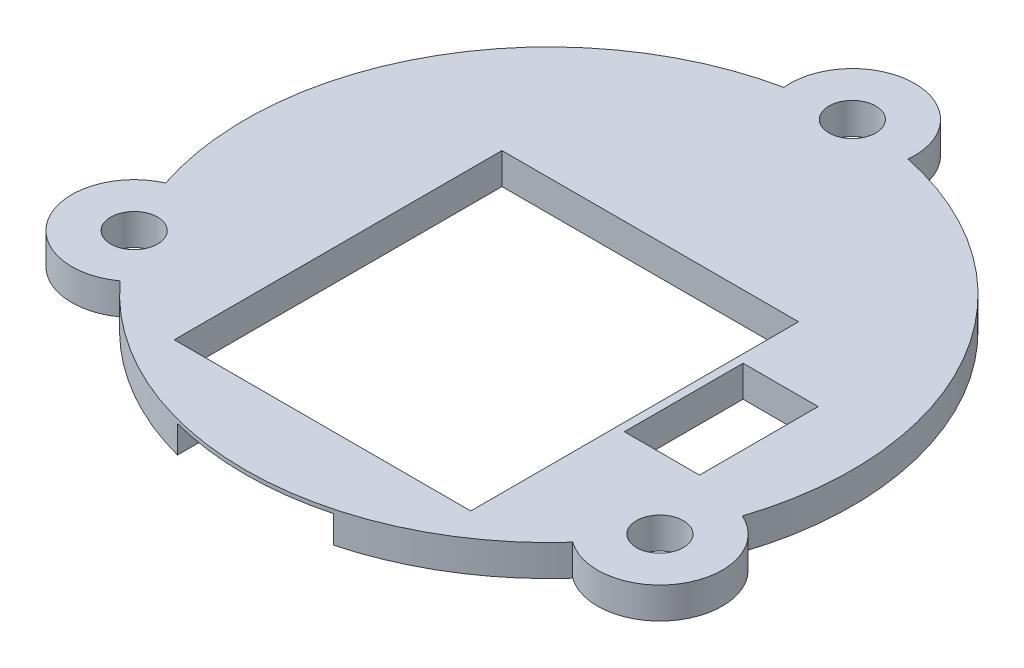
from build123d import *

# Parameters (mm, degrees)
ESQUISSE2_R                    = 19.45
BOSS_EXTRU_1_DEPTH             = 2
ESQUISSE2_3_R                  = 19.45
ESQUISSE2_3_R_2                = 4
ESQUISSE2_3_R_3                = 1.5
BOSS_EXTRU_2_DEPTH             = 2
ENL_V_MAT_EXTRU_2_DEPTH        = 2
R_P_TITION_CIRCULAIRE1_DEPTH   = 2
R_P_TITION_CIRCULAIRE1_2_DEPTH = 2
BOSS_EXTRU_3_DEPTH             = 0.8
CONG_1_R                       = 2
ESQUISSE6_W                    = 4.812747309
ESQUISSE6_H                    = 7.603139871
ENL_V_MAT_EXTRU_3_DEPTH        = 10
ESQUISSE7_W                    = 19
ESQUISSE7_H                    = 21
ENL_V_MAT_EXTRU_4_DEPTH        = 3.5
ESQUISSE8_W                    = 10
ESQUISSE8_H                    = 6.246978905
ENL_V_MAT_EXTRU_5_DEPTH        = 1.75


# Read off the part's stored shape, not the designer's step: Répétition circulaire1
with BuildPart() as part:
    # Esquisse2 → Boss.-Extru.1 (new body)
    with BuildSketch(Plane(origin=(0, 0, 0), x_dir=(1, 0, 0), z_dir=(0, 1, 0))):
        with Locations(Location((0, 0, 0), (0, 0, 270))):
            Circle(ESQUISSE2_R)
    extrude(amount=BOSS_EXTRU_1_DEPTH)

    # Esquisse2<3> → Boss.-Extru.2 (add)
    # profile 1 of 2: a face of its own
    with BuildSketch(Plane(origin=(0, 0, 0), x_dir=(1, 0, 0), z_dir=(0, 1, 0))):
        Circle(ESQUISSE2_3_R)
    # profile 2 of 2: a face of its own
    with BuildSketch(Plane(origin=(0, 0, 0), x_dir=(1, 0, 0), z_dir=(0, 1, 0))):
        with Locations((0, 19.45)):
            Circle(ESQUISSE2_3_R_2)
        with Locations((0, 19.45)):
            Circle(ESQUISSE2_3_R_3, mode=Mode.SUBTRACT)
    extrude(amount=BOSS_EXTRU_2_DEPTH)

    # Esquisse2<4> → Enlèv. mat.-Extru.2 (cut)
    with BuildSketch(Plane(origin=(0, 0, 0), x_dir=(1, 0, 0), z_dir=(0, 1, 0))):
        with BuildLine():
            ThreePointArc((1.498884406, 19.392159383), (0.75, 19.435534467), (0, 19.45))
            Line((0, 19.45), (0, 17.95))
            ThreePointArc((0, 17.95), (1.040009393, 18.369083508), (1.498884406, 19.392159383))
        make_face()
        with BuildLine():
            Line((0, 17.95), (0, 19.45))
            ThreePointArc((0, 19.45), (-0.75, 19.435534467), (-1.498884406, 19.392159383))
            ThreePointArc((-1.498884406, 19.392159383), (-1.040009393, 18.369083508), (0, 17.95))
        make_face()
    extrude(amount=ENL_V_MAT_EXTRU_2_DEPTH, mode=Mode.SUBTRACT)

    # Répétition circulaire1 outline → Répétition circulaire1 (cut)
    with BuildSketch(Plane(origin=(0, 0, 0), x_dir=(1, 0, 0), z_dir=(0, 1, 0))):
        with BuildLine():
            ThreePointArc((16.044660457, -10.994151664), (16.844194104, -9.725), (17.543544863, -8.398007718))
            ThreePointArc((17.543544863, -8.398007718), (15.545155998, -8.975), (16.044660457, -10.994151664))
        make_face()
        with BuildLine():
            ThreePointArc((-17.543544863, -8.398007718), (-16.844194104, -9.725), (-16.044660457, -10.994151664))
            ThreePointArc((-16.044660457, -10.994151664), (-15.545155998, -8.975), (-17.543544863, -8.398007718))
        make_face()
    extrude(amount=R_P_TITION_CIRCULAIRE1_DEPTH, mode=Mode.SUBTRACT)

    # R_p_tition circulaire1 2 outline → R_p_tition circulaire1 2 (add)
    with BuildSketch(Plane(origin=(0, 0, 0), x_dir=(1, 0, 0), z_dir=(0, 1, 0))):
        with BuildLine():
            ThreePointArc((17.543544863, -8.398007718), (18.14323221, -10.475), (16.044660457, -10.994151664))
            ThreePointArc((16.044660457, -10.994151664), (15.303387831, -12.004533347), (14.49858993, -12.965083496))
            ThreePointArc((14.49858993, -12.965083496), (20.308295719, -11.725), (18.477386634, -6.07360545))
            ThreePointArc((18.477386634, -6.07360545), (18.047924755, -7.250855952), (17.543544863, -8.398007718))
        make_face()
        with BuildLine():
            ThreePointArc((-18.477386634, -6.07360545), (-20.308295719, -11.725), (-14.49858993, -12.965083496))
            ThreePointArc((-14.49858993, -12.965083496), (-15.303387831, -12.004533347), (-16.044660457, -10.994151664))
            ThreePointArc((-16.044660457, -10.994151664), (-18.14323221, -10.475), (-17.543544863, -8.398007718))
            ThreePointArc((-17.543544863, -8.398007718), (-18.047924755, -7.250855952), (-18.477386634, -6.07360545))
        make_face()
    extrude(amount=R_P_TITION_CIRCULAIRE1_2_DEPTH)

    # Esquisse5 → Boss.-Extru.3 (add)
    with BuildSketch(Plane.XZ):
        with BuildLine():
            Line((8.673984211, -13.97728507), (9.39907569, -14.702376549))
            ThreePointArc((9.39907569, -14.702376549), (12.339013332, -12.339013332), (14.702376549, -9.39907569))
            Line((14.702376549, -9.39907569), (13.97728507, -8.673984211))
            ThreePointArc((13.97728507, -8.673984211), (11.631906551, -11.631906551), (8.673984211, -13.97728507))
        make_face()
        with BuildLine():
            ThreePointArc((-14.702376549, -9.39907569), (-12.339013332, -12.339013332), (-9.39907569, -14.702376549))
            Line((-9.39907569, -14.702376549), (-8.673984211, -13.97728507))
            ThreePointArc((-8.673984211, -13.97728507), (-11.631906551, -11.631906551), (-13.97728507, -8.673984211))
            Line((-13.97728507, -8.673984211), (-14.702376549, -9.39907569))
        make_face()
        with BuildLine():
            Line((13.97728507, 8.673984211), (14.702376549, 9.39907569))
            ThreePointArc((14.702376549, 9.39907569), (13.600367642, 10.933091969), (12.339013332, 12.339013332))
            Line((12.339013332, 12.339013332), (11.631906551, 11.631906551))
            ThreePointArc((11.631906551, 11.631906551), (12.88972459, 10.220445196), (13.97728507, 8.673984211))
        make_face()
        with BuildLine():
            ThreePointArc((-12.339013332, 12.339013332), (-13.600367642, 10.933091969), (-14.702376549, 9.39907569))
            Line((-14.702376549, 9.39907569), (-13.97728507, 8.673984211))
            ThreePointArc((-13.97728507, 8.673984211), (-12.88972459, 10.220445196), (-11.631906551, 11.631906551))
            Line((-11.631906551, 11.631906551), (-12.339013332, 12.339013332))
        make_face()
    extrude(amount=BOSS_EXTRU_3_DEPTH)

    # Congé1
    # the kernel refuses this fillet: 2 mm, written as the material it adds along each edge
    with BuildSketch(Plane(origin=(11.148857945, 0, 5.845557086), x_dir=(0.7071067811865459, 0, -0.7071067811865492), z_dir=(0.7071067811865492, 0, 0.7071067811865458))) as cong_1_piece_1_section:
        with BuildLine():
            CenterArc((1.6, -2), CONG_1_R, 90, 53.130102354)
            Line((0, -0.8), (-0.032, -0.776))
            ThreePointArc((-0.032, -0.776), (-0.04, -0.4), (-0.04, 0))
            Line((-0.04, 0), (0, 0.04))
            Line((0, 0.04), (1.6, 0.04))
            Line((1.6, 0.04), (1.6, 0))
        make_face()
    cong_1_piece_1 = extrude(amount=9.025434204, mode=Mode.PRIVATE)
    cong_1_piece_1 = cong_1_piece_1 & Plane(origin=(0, -0.204103776, 0), x_dir=(0.8425430686905786, 0, 0.5386289793554215), z_dir=(0, 1, 0)) * Cylinder(17.45, 25, mode=Mode.PRIVATE)
    cong_1_piece_1 = cong_1_piece_1 - Plane(origin=(0, -0.204103776, 0), x_dir=(0.7071067811865577, 0, 0.7071067811865375), z_dir=(0, 1, 0)) * Cylinder(16.45, 25, mode=Mode.PRIVATE)
    add(cong_1_piece_1)
    with BuildSketch(Plane(origin=(0, 0, 0), x_dir=(0.7071067811865576, 0, 0.7071067811865375), z_dir=(-0.7071067811865375, 0, 0.7071067811865576))) as cong_1_piece_2_section:
        with BuildLine():
            CenterArc((14.85, -2), CONG_1_R, 36.869897646, 53.130102354)
            Line((16.45, -0.8), (16.482, -0.776))
            ThreePointArc((16.482, -0.776), (16.49, -0.4), (16.49, 0))
            Line((16.49, 0), (16.45, 0.04))
            Line((16.45, 0.04), (14.85, 0.04))
            Line((14.85, 0.04), (14.85, 0))
        make_face()
    cong_1_piece_2 = revolve(axis=Axis((0, 0, 0), (0, 1, 0)), revolution_arc=27.109429972, mode=Mode.PRIVATE)
    cong_1_piece_2 = split(cong_1_piece_2, bisect_by=Plane(origin=(13.88723244, -0.204725798, 8.583931581), z_dir=(-0.7071067811865458, 0, 0.7071067811865492)), keep=Keep.TOP, mode=Mode.PRIVATE)
    add(cong_1_piece_2)
    with BuildSketch(Plane(origin=(0, 0, 0), x_dir=(-0.9516449769891426, 0, 0.30719999637261464), z_dir=(-0.30719999637261464, 0, -0.9516449769891426))) as cong_1_piece_3_section:
        with BuildLine():
            CenterArc((14.85, -2), CONG_1_R, 36.869897646, 53.130102354)
            Line((16.45, -0.8), (16.482, -0.776))
            ThreePointArc((16.482, -0.776), (16.49, -0.4), (16.49, 0))
            Line((16.49, 0), (16.45, 0.04))
            Line((16.45, 0.04), (14.85, 0.04))
            Line((14.85, 0.04), (14.85, 0))
        make_face()
    cong_1_piece_3 = revolve(axis=Axis((0, 0, 0), (0, 1, 0)), revolution_arc=27.109429972, mode=Mode.PRIVATE)
    cong_1_piece_3 = split(cong_1_piece_3, bisect_by=Plane(origin=(-13.887232342, -0.20472579, 8.583931483), z_dir=(0.7071067811865458, 0, 0.7071067811865493)), keep=Keep.TOP, mode=Mode.PRIVATE)
    add(cong_1_piece_3)
    with BuildSketch(Plane(origin=(-17.530803673, 0, 12.227502814), x_dir=(-0.7071067811865458, 0, -0.7071067811865493), z_dir=(0.7071067811865493, 0, -0.7071067811865458))) as cong_1_piece_4_section:
        with BuildLine():
            CenterArc((1.6, -2), CONG_1_R, 90, 53.130102354)
            Line((0, -0.8), (-0.032, -0.776))
            ThreePointArc((-0.032, -0.776), (-0.04, -0.4), (-0.04, 0))
            Line((-0.04, 0), (0, 0.04))
            Line((0, 0.04), (1.6, 0.04))
            Line((1.6, 0.04), (1.6, 0))
        make_face()
    cong_1_piece_4 = extrude(amount=9.025434204, mode=Mode.PRIVATE)
    cong_1_piece_4 = cong_1_piece_4 & Plane(origin=(0, -0.204103718, 0), x_dir=(-0.7071067811865558, 0, 0.7071067811865394), z_dir=(0, 1, 0)) * Cylinder(17.45, 25, mode=Mode.PRIVATE)
    cong_1_piece_4 = cong_1_piece_4 - Plane(origin=(0, -0.204103718, 0), x_dir=(-0.8496829829485655, 0, 0.527293872985101), z_dir=(0, 1, 0)) * Cylinder(16.45, 25, mode=Mode.PRIVATE)
    add(cong_1_piece_4)
    with BuildSketch(Plane(origin=(17.530803673, 0, -12.227502814), x_dir=(0.7071067811865459, 0, 0.7071067811865492), z_dir=(-0.7071067811865492, 0, 0.7071067811865458))) as cong_1_piece_5_section:
        with BuildLine():
            CenterArc((1.6, -2), CONG_1_R, 90, 53.130102354)
            Line((0, -0.8), (-0.032, -0.776))
            ThreePointArc((-0.032, -0.776), (-0.04, -0.4), (-0.04, 0))
            Line((-0.04, 0), (0, 0.04))
            Line((0, 0.04), (1.6, 0.04))
            Line((1.6, 0.04), (1.6, 0))
        make_face()
    cong_1_piece_5 = extrude(amount=9.025434204, mode=Mode.PRIVATE)
    cong_1_piece_5 = cong_1_piece_5 & Plane(origin=(0, -0.204103718, 0), x_dir=(0.5386289793554239, 0, -0.8425430686905769), z_dir=(0, 1, 0)) * Cylinder(17.45, 25, mode=Mode.PRIVATE)
    cong_1_piece_5 = cong_1_piece_5 - Plane(origin=(0, -0.204103718, 0), x_dir=(0.849682982948563, 0, -0.5272938729851051), z_dir=(0, 1, 0)) * Cylinder(16.45, 25, mode=Mode.PRIVATE)
    add(cong_1_piece_5)
    with BuildSketch(Plane(origin=(0, 0, 0), x_dir=(0.9516469062705674, 0, -0.30719401977521954), z_dir=(0.30719401977521954, 0, 0.9516469062705674))) as cong_1_piece_6_section:
        with BuildLine():
            CenterArc((14.85, -2), CONG_1_R, 36.869897646, 53.130102354)
            Line((16.45, -0.8), (16.482, -0.776))
            ThreePointArc((16.482, -0.776), (16.49, -0.4), (16.49, 0))
            Line((16.49, 0), (16.45, 0.04))
            Line((16.45, 0.04), (14.85, 0.04))
            Line((14.85, 0.04), (14.85, 0))
        make_face()
    cong_1_piece_6 = revolve(axis=Axis((0, 0, 0), (0, 1, 0)), revolution_arc=54.21957961, mode=Mode.PRIVATE)
    cong_1_piece_6 = split(cong_1_piece_6, bisect_by=Plane(origin=(8.583931605, -0.20472582, -13.887232464), z_dir=(0.7071067811865467, 0, 0.7071067811865485)), keep=Keep.TOP, mode=Mode.PRIVATE)
    cong_1_piece_6 = split(cong_1_piece_6, bisect_by=Plane(origin=(13.887232464, -0.20472582, -8.583931605), z_dir=(-0.7071067811865458, 0, -0.7071067811865492)), keep=Keep.TOP, mode=Mode.PRIVATE)
    add(cong_1_piece_6)
    with BuildSketch(Plane(origin=(5.845557086, 0, -11.148857945), x_dir=(-0.7071067811865465, 0, -0.7071067811865485), z_dir=(0.7071067811865485, 0, -0.7071067811865467))) as cong_1_piece_7_section:
        with BuildLine():
            CenterArc((1.6, -2), CONG_1_R, 90, 53.130102354)
            Line((0, -0.8), (-0.032, -0.776))
            ThreePointArc((-0.032, -0.776), (-0.04, -0.4), (-0.04, 0))
            Line((-0.04, 0), (0, 0.04))
            Line((0, 0.04), (1.6, 0.04))
            Line((1.6, 0.04), (1.6, 0))
        make_face()
    cong_1_piece_7 = extrude(amount=9.025434204, mode=Mode.PRIVATE)
    cong_1_piece_7 = cong_1_piece_7 & Plane(origin=(0, -0.204103776, 0), x_dir=(0.5386289793554239, 0, -0.8425430686905769), z_dir=(0, 1, 0)) * Cylinder(17.45, 25, mode=Mode.PRIVATE)
    cong_1_piece_7 = cong_1_piece_7 - Plane(origin=(0, -0.204103776, 0), x_dir=(0.849682982948563, 0, -0.5272938729851051), z_dir=(0, 1, 0)) * Cylinder(16.45, 25, mode=Mode.PRIVATE)
    add(cong_1_piece_7)
    with BuildSketch(Plane(origin=(-12.227502814, 0, -17.530803673), x_dir=(0.7071067811865467, 0, -0.7071067811865483), z_dir=(0.7071067811865485, 0, 0.7071067811865467))) as cong_1_piece_8_section:
        with BuildLine():
            CenterArc((1.6, -2), CONG_1_R, 90, 53.130102354)
            Line((0, -0.8), (-0.032, -0.776))
            ThreePointArc((-0.032, -0.776), (-0.04, -0.4), (-0.04, 0))
            Line((-0.04, 0), (0, 0.04))
            Line((0, 0.04), (1.6, 0.04))
            Line((1.6, 0.04), (1.6, 0))
        make_face()
    cong_1_piece_8 = extrude(amount=9.025434204, mode=Mode.PRIVATE)
    cong_1_piece_8 = cong_1_piece_8 & Plane(origin=(0, -0.204103718, 0), x_dir=(-0.8425430686905772, 0, -0.5386289793554238), z_dir=(0, 1, 0)) * Cylinder(17.45, 25, mode=Mode.PRIVATE)
    cong_1_piece_8 = cong_1_piece_8 - Plane(origin=(0, -0.204103718, 0), x_dir=(-0.5272938729851264, 0, -0.8496829829485496), z_dir=(0, 1, 0)) * Cylinder(16.45, 25, mode=Mode.PRIVATE)
    add(cong_1_piece_8)
    with BuildSketch(Plane(origin=(0, 0, 0), x_dir=(-0.30719401977524424, 0, -0.9516469062705595), z_dir=(0.9516469062705595, 0, -0.30719401977524424))) as cong_1_piece_9_section:
        with BuildLine():
            CenterArc((14.85, -2), CONG_1_R, 36.869897646, 53.130102354)
            Line((16.45, -0.8), (16.482, -0.776))
            ThreePointArc((16.482, -0.776), (16.49, -0.4), (16.49, 0))
            Line((16.49, 0), (16.45, 0.04))
            Line((16.45, 0.04), (14.85, 0.04))
            Line((14.85, 0.04), (14.85, 0))
        make_face()
    cong_1_piece_9 = revolve(axis=Axis((0, 0, 0), (0, 1, 0)), revolution_arc=54.21957961, mode=Mode.PRIVATE)
    cong_1_piece_9 = split(cong_1_piece_9, bisect_by=Plane(origin=(-8.583931605, -0.20472582, -13.887232464), z_dir=(-0.7071067811865467, 0, 0.7071067811865485)), keep=Keep.TOP, mode=Mode.PRIVATE)
    cong_1_piece_9 = split(cong_1_piece_9, bisect_by=Plane(origin=(-13.887232464, -0.20472582, -8.583931605), z_dir=(0.7071067811865458, 0, -0.7071067811865492)), keep=Keep.TOP, mode=Mode.PRIVATE)
    add(cong_1_piece_9)
    with BuildSketch(Plane(origin=(-11.148857945, 0, -5.845557086), x_dir=(-0.7071067811865459, 0, 0.7071067811865492), z_dir=(-0.7071067811865492, 0, -0.7071067811865458))) as cong_1_piece_10_section:
        with BuildLine():
            CenterArc((1.6, -2), CONG_1_R, 90, 53.130102354)
            Line((0, -0.8), (-0.032, -0.776))
            ThreePointArc((-0.032, -0.776), (-0.04, -0.4), (-0.04, 0))
            Line((-0.04, 0), (0, 0.04))
            Line((0, 0.04), (1.6, 0.04))
            Line((1.6, 0.04), (1.6, 0))
        make_face()
    cong_1_piece_10 = extrude(amount=9.025434204, mode=Mode.PRIVATE)
    cong_1_piece_10 = cong_1_piece_10 & Plane(origin=(0, -0.204103776, 0), x_dir=(-0.8425430686905772, 0, -0.5386289793554238), z_dir=(0, 1, 0)) * Cylinder(17.45, 25, mode=Mode.PRIVATE)
    cong_1_piece_10 = cong_1_piece_10 - Plane(origin=(0, -0.204103776, 0), x_dir=(-0.5272938729851264, 0, -0.8496829829485496), z_dir=(0, 1, 0)) * Cylinder(16.45, 25, mode=Mode.PRIVATE)
    add(cong_1_piece_10)
    with BuildSketch(Plane(origin=(11.148857945, 0, 5.845557086), x_dir=(0.7071067811865459, 0, -0.7071067811865492), z_dir=(0.7071067811865492, 0, 0.7071067811865458))) as cong_1_piece_11a_section:
        with BuildLine():
            CenterArc((1.6, -2), CONG_1_R, 90, 53.130102354)
            Line((0, -0.8), (-0.032, -0.776))
            ThreePointArc((-0.032, -0.776), (-0.04, -0.4), (-0.04, 0))
            Line((-0.04, 0), (0, 0.04))
            Line((0, 0.04), (1.6, 0.04))
            Line((1.6, 0.04), (1.6, 0))
        make_face()
    cong_1_piece_11a = extrude(amount=9.025434204, mode=Mode.PRIVATE)
    cong_1_piece_11a = cong_1_piece_11a & Plane(origin=(0, -0.207693111, 0), x_dir=(0.7071067811865577, 0, 0.7071067811865375), z_dir=(0, 1, 0)) * Cylinder(16.45, 25, mode=Mode.PRIVATE)
    with BuildSketch(Plane(origin=(0, 0, 0), x_dir=(0.7071067811865576, 0, 0.7071067811865375), z_dir=(-0.7071067811865375, 0, 0.7071067811865576))) as cong_1_piece_11b_section:
        with BuildLine():
            CenterArc((14.85, -2), CONG_1_R, 36.869897646, 53.130102354)
            Line((16.45, -0.8), (16.482, -0.776))
            ThreePointArc((16.482, -0.776), (16.49, -0.4), (16.49, 0))
            Line((16.49, 0), (16.45, 0.04))
            Line((16.45, 0.04), (14.85, 0.04))
            Line((14.85, 0.04), (14.85, 0))
        make_face()
    cong_1_piece_11b = revolve(axis=Axis((0, 0, 0), (0, 1, 0)), revolution_arc=27.109429972, mode=Mode.PRIVATE)
    cong_1_piece_11b = split(cong_1_piece_11b, bisect_by=Plane(origin=(13.273689354, -0.210053776, 7.970388495), z_dir=(0.7071067811865458, 0, -0.7071067811865492)), keep=Keep.TOP, mode=Mode.PRIVATE)
    cong_1_piece_11 = cong_1_piece_11a & cong_1_piece_11b
    add(cong_1_piece_11)
    with BuildSketch(Plane(origin=(0, 0, 0), x_dir=(-0.9516449769891426, 0, 0.30719999637261464), z_dir=(-0.30719999637261464, 0, -0.9516449769891426))) as cong_1_piece_12a_section:
        with BuildLine():
            CenterArc((14.85, -2), CONG_1_R, 36.869897646, 53.130102354)
            Line((16.45, -0.8), (16.482, -0.776))
            ThreePointArc((16.482, -0.776), (16.49, -0.4), (16.49, 0))
            Line((16.49, 0), (16.45, 0.04))
            Line((16.45, 0.04), (14.85, 0.04))
            Line((14.85, 0.04), (14.85, 0))
        make_face()
    cong_1_piece_12a = revolve(axis=Axis((0, 0, 0), (0, 1, 0)), revolution_arc=27.109429972, mode=Mode.PRIVATE)
    cong_1_piece_12a = split(cong_1_piece_12a, bisect_by=Plane(origin=(-13.273689161, -0.21005368, 7.970388302), z_dir=(-0.7071067811865458, 0, -0.7071067811865493)), keep=Keep.TOP, mode=Mode.PRIVATE)
    with BuildSketch(Plane(origin=(-17.530803673, 0, 12.227502814), x_dir=(-0.7071067811865458, 0, -0.7071067811865493), z_dir=(0.7071067811865493, 0, -0.7071067811865458))) as cong_1_piece_12b_section:
        with BuildLine():
            CenterArc((1.6, -2), CONG_1_R, 90, 53.130102354)
            Line((0, -0.8), (-0.032, -0.776))
            ThreePointArc((-0.032, -0.776), (-0.04, -0.4), (-0.04, 0))
            Line((-0.04, 0), (0, 0.04))
            Line((0, 0.04), (1.6, 0.04))
            Line((1.6, 0.04), (1.6, 0))
        make_face()
    cong_1_piece_12b = extrude(amount=9.025434204, mode=Mode.PRIVATE)
    cong_1_piece_12b = cong_1_piece_12b & Plane(origin=(0, -0.207693101, 0), x_dir=(-0.8496829829485655, 0, 0.527293872985101), z_dir=(0, 1, 0)) * Cylinder(16.45, 25, mode=Mode.PRIVATE)
    cong_1_piece_12 = cong_1_piece_12a & cong_1_piece_12b
    add(cong_1_piece_12)
    with BuildSketch(Plane(origin=(0, 0, 0), x_dir=(0.9516469062705674, 0, -0.30719401977521954), z_dir=(0.30719401977521954, 0, 0.9516469062705674))) as cong_1_piece_13a_section:
        with BuildLine():
            CenterArc((14.85, -2), CONG_1_R, 36.869897646, 53.130102354)
            Line((16.45, -0.8), (16.482, -0.776))
            ThreePointArc((16.482, -0.776), (16.49, -0.4), (16.49, 0))
            Line((16.49, 0), (16.45, 0.04))
            Line((16.45, 0.04), (14.85, 0.04))
            Line((14.85, 0.04), (14.85, 0))
        make_face()
    cong_1_piece_13a = revolve(axis=Axis((0, 0, 0), (0, 1, 0)), revolution_arc=54.21957961, mode=Mode.PRIVATE)
    cong_1_piece_13a = split(cong_1_piece_13a, bisect_by=Plane(origin=(13.27367534, -0.21005361, -7.970374481), z_dir=(0.7071067811865458, 0, 0.7071067811865492)), keep=Keep.TOP, mode=Mode.PRIVATE)
    with BuildSketch(Plane(origin=(17.530803673, 0, -12.227502814), x_dir=(0.7071067811865459, 0, 0.7071067811865492), z_dir=(-0.7071067811865492, 0, 0.7071067811865458))) as cong_1_piece_13b_section:
        with BuildLine():
            CenterArc((1.6, -2), CONG_1_R, 90, 53.130102354)
            Line((0, -0.8), (-0.032, -0.776))
            ThreePointArc((-0.032, -0.776), (-0.04, -0.4), (-0.04, 0))
            Line((-0.04, 0), (0, 0.04))
            Line((0, 0.04), (1.6, 0.04))
            Line((1.6, 0.04), (1.6, 0))
        make_face()
    cong_1_piece_13b = extrude(amount=9.025434204, mode=Mode.PRIVATE)
    cong_1_piece_13b = cong_1_piece_13b & Plane(origin=(0, -0.207693101, 0), x_dir=(0.849682982948563, 0, -0.5272938729851051), z_dir=(0, 1, 0)) * Cylinder(16.45, 25, mode=Mode.PRIVATE)
    cong_1_piece_13 = cong_1_piece_13a & cong_1_piece_13b
    add(cong_1_piece_13)
    with BuildSketch(Plane(origin=(5.845557086, 0, -11.148857945), x_dir=(-0.7071067811865465, 0, -0.7071067811865485), z_dir=(0.7071067811865485, 0, -0.7071067811865467))) as cong_1_piece_14a_section:
        with BuildLine():
            CenterArc((1.6, -2), CONG_1_R, 90, 53.130102354)
            Line((0, -0.8), (-0.032, -0.776))
            ThreePointArc((-0.032, -0.776), (-0.04, -0.4), (-0.04, 0))
            Line((-0.04, 0), (0, 0.04))
            Line((0, 0.04), (1.6, 0.04))
            Line((1.6, 0.04), (1.6, 0))
        make_face()
    cong_1_piece_14a = extrude(amount=9.025434204, mode=Mode.PRIVATE)
    cong_1_piece_14a = cong_1_piece_14a & Plane(origin=(0, -0.207693111, 0), x_dir=(0.849682982948563, 0, -0.5272938729851051), z_dir=(0, 1, 0)) * Cylinder(16.45, 25, mode=Mode.PRIVATE)
    with BuildSketch(Plane(origin=(0, 0, 0), x_dir=(0.9516469062705674, 0, -0.30719401977521954), z_dir=(0.30719401977521954, 0, 0.9516469062705674))) as cong_1_piece_14b_section:
        with BuildLine():
            CenterArc((14.85, -2), CONG_1_R, 36.869897646, 53.130102354)
            Line((16.45, -0.8), (16.482, -0.776))
            ThreePointArc((16.482, -0.776), (16.49, -0.4), (16.49, 0))
            Line((16.49, 0), (16.45, 0.04))
            Line((16.45, 0.04), (14.85, 0.04))
            Line((14.85, 0.04), (14.85, 0))
        make_face()
    cong_1_piece_14b = revolve(axis=Axis((0, 0, 0), (0, 1, 0)), revolution_arc=54.21957961, mode=Mode.PRIVATE)
    cong_1_piece_14b = split(cong_1_piece_14b, bisect_by=Plane(origin=(7.970374673, -0.210053705, -13.273675532), z_dir=(-0.7071067811865467, 0, -0.7071067811865485)), keep=Keep.TOP, mode=Mode.PRIVATE)
    cong_1_piece_14 = cong_1_piece_14a & cong_1_piece_14b
    add(cong_1_piece_14)
    with BuildSketch(Plane(origin=(-12.227502814, 0, -17.530803673), x_dir=(0.7071067811865467, 0, -0.7071067811865483), z_dir=(0.7071067811865485, 0, 0.7071067811865467))) as cong_1_piece_15a_section:
        with BuildLine():
            CenterArc((1.6, -2), CONG_1_R, 90, 53.130102354)
            Line((0, -0.8), (-0.032, -0.776))
            ThreePointArc((-0.032, -0.776), (-0.04, -0.4), (-0.04, 0))
            Line((-0.04, 0), (0, 0.04))
            Line((0, 0.04), (1.6, 0.04))
            Line((1.6, 0.04), (1.6, 0))
        make_face()
    cong_1_piece_15a = extrude(amount=9.025434204, mode=Mode.PRIVATE)
    cong_1_piece_15a = cong_1_piece_15a & Plane(origin=(0, -0.207693101, 0), x_dir=(-0.5272938729851264, 0, -0.8496829829485496), z_dir=(0, 1, 0)) * Cylinder(16.45, 25, mode=Mode.PRIVATE)
    with BuildSketch(Plane(origin=(0, 0, 0), x_dir=(-0.30719401977524424, 0, -0.9516469062705595), z_dir=(0.9516469062705595, 0, -0.30719401977524424))) as cong_1_piece_15b_section:
        with BuildLine():
            CenterArc((14.85, -2), CONG_1_R, 36.869897646, 53.130102354)
            Line((16.45, -0.8), (16.482, -0.776))
            ThreePointArc((16.482, -0.776), (16.49, -0.4), (16.49, 0))
            Line((16.49, 0), (16.45, 0.04))
            Line((16.45, 0.04), (14.85, 0.04))
            Line((14.85, 0.04), (14.85, 0))
        make_face()
    cong_1_piece_15b = revolve(axis=Axis((0, 0, 0), (0, 1, 0)), revolution_arc=54.21957961, mode=Mode.PRIVATE)
    cong_1_piece_15b = split(cong_1_piece_15b, bisect_by=Plane(origin=(-7.970374481, -0.21005361, -13.27367534), z_dir=(0.7071067811865467, 0, -0.7071067811865485)), keep=Keep.TOP, mode=Mode.PRIVATE)
    cong_1_piece_15 = cong_1_piece_15a & cong_1_piece_15b
    add(cong_1_piece_15)
    with BuildSketch(Plane(origin=(-11.148857945, 0, -5.845557086), x_dir=(-0.7071067811865459, 0, 0.7071067811865492), z_dir=(-0.7071067811865492, 0, -0.7071067811865458))) as cong_1_piece_16a_section:
        with BuildLine():
            CenterArc((1.6, -2), CONG_1_R, 90, 53.130102354)
            Line((0, -0.8), (-0.032, -0.776))
            ThreePointArc((-0.032, -0.776), (-0.04, -0.4), (-0.04, 0))
            Line((-0.04, 0), (0, 0.04))
            Line((0, 0.04), (1.6, 0.04))
            Line((1.6, 0.04), (1.6, 0))
        make_face()
    cong_1_piece_16a = extrude(amount=9.025434204, mode=Mode.PRIVATE)
    cong_1_piece_16a = cong_1_piece_16a & Plane(origin=(0, -0.207693111, 0), x_dir=(-0.5272938729851264, 0, -0.8496829829485496), z_dir=(0, 1, 0)) * Cylinder(16.45, 25, mode=Mode.PRIVATE)
    with BuildSketch(Plane(origin=(0, 0, 0), x_dir=(-0.30719401977524424, 0, -0.9516469062705595), z_dir=(0.9516469062705595, 0, -0.30719401977524424))) as cong_1_piece_16b_section:
        with BuildLine():
            CenterArc((14.85, -2), CONG_1_R, 36.869897646, 53.130102354)
            Line((16.45, -0.8), (16.482, -0.776))
            ThreePointArc((16.482, -0.776), (16.49, -0.4), (16.49, 0))
            Line((16.49, 0), (16.45, 0.04))
            Line((16.45, 0.04), (14.85, 0.04))
            Line((14.85, 0.04), (14.85, 0))
        make_face()
    cong_1_piece_16b = revolve(axis=Axis((0, 0, 0), (0, 1, 0)), revolution_arc=54.21957961, mode=Mode.PRIVATE)
    cong_1_piece_16b = split(cong_1_piece_16b, bisect_by=Plane(origin=(-13.273675532, -0.210053705, -7.970374673), z_dir=(-0.7071067811865458, 0, 0.7071067811865492)), keep=Keep.TOP, mode=Mode.PRIVATE)
    cong_1_piece_16 = cong_1_piece_16a & cong_1_piece_16b
    add(cong_1_piece_16)

    # Esquisse6 → Enlèv. mat.-Extru.3 (cut)
    with BuildSketch(Plane.XZ):
        with Locations((12.430469628, 1.379302172)):
            Rectangle(ESQUISSE6_W, ESQUISSE6_H)
    extrude(amount=-ENL_V_MAT_EXTRU_3_DEPTH, mode=Mode.SUBTRACT)

    # Esquisse7 → Enlèv. mat.-Extru.4 (cut)
    with BuildSketch(Plane.XZ):
        with Locations((0, 4)):
            Rectangle(ESQUISSE7_W, ESQUISSE7_H)
    extrude(amount=-ENL_V_MAT_EXTRU_4_DEPTH, mode=Mode.SUBTRACT)

    # Esquisse8 → Enlèv. mat.-Extru.5 (cut)
    with BuildSketch(Plane.XZ):
        with Locations((0, 16.56378264)):
            Rectangle(ESQUISSE8_W, ESQUISSE8_H)
    extrude(amount=-ENL_V_MAT_EXTRU_5_DEPTH, mode=Mode.SUBTRACT)


solid = part.part
